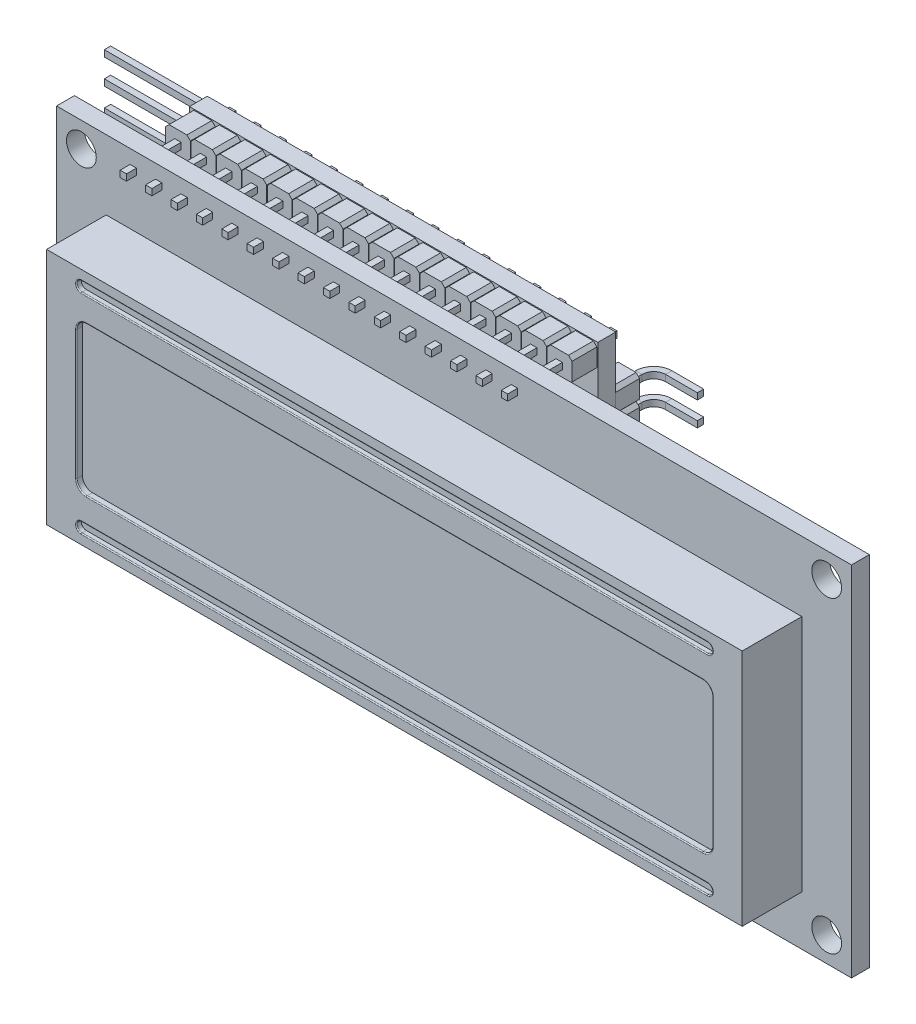
from build123d import *

# Parameters (mm, degrees)
SKETCH1_W                     = 80
SKETCH1_H                     = 36
SILICON_CHIP_DEPTH            = 1.8
SKETCH2_R                     = 1.5
SCREW_HOLES_DEPTH             = 1.8
PINS_DEPTH                    = 1
PINS_DEPTH_BACK               = 10
SKETCH3_W                     = 0.639344262
SKETCH3_H                     = 0.639344262
SKETCH3_W_2                   = 0.639344263
PIN_HOLDERS_START             = -4.5
PIN_HOLDERS_DEPTH             = 2.5
SKETCH5_W                     = 41.1
SKETCH5_H                     = 18
SILICON_CHIP_2_DEPTH          = 1.8
SKETCH6_W                     = 7
SKETCH6_H                     = 7
VARIABLE_RESISTOR_DEPTH       = 5
SCREWDRIVER_HOLE_LVL_2_DEPTH  = 1
SKETCH8_R                     = 1.3
SCREW_DRIVER_HOLE_LVL_1_DEPTH = 0.1
PINHOLDERS_2_DEPTH            = 2.5
SKETCH11_W                    = 0.64
SKETCH11_H                    = 0.64
BENT_PINS_COUNT               = 4
BENT_PINS_PITCH               = 2.54
SKETCH12_W                    = 7
SKETCH12_H                    = 10
IC_DEPTH                      = 2
SKETCH14_W                    = 0.5
SKETCH14_H                    = 0.5
IC_PINS_1_COUNT               = 8
IC_PINS_1_PITCH               = 1.1
IC_PINS_2_COPY_1_SKETCH_W     = 0.5
IC_PINS_2_COPY_1_SKETCH_H     = 0.5
IC_PINS_2_COPY_2_SKETCH_W     = 0.5
IC_PINS_2_COPY_2_SKETCH_H     = 0.5
IC_PINS_2_COPY_3_SKETCH_W     = 0.5
IC_PINS_2_COPY_3_SKETCH_H     = 0.5
IC_PINS_2_COPY_4_SKETCH_W     = 0.5
IC_PINS_2_COPY_4_SKETCH_H     = 0.5
IC_PINS_2_COPY_5_SKETCH_W     = 0.5
IC_PINS_2_COPY_5_SKETCH_H     = 0.5
IC_PINS_2_COPY_6_SKETCH_W     = 0.5
IC_PINS_2_COPY_6_SKETCH_H     = 0.5
IC_PINS_2_COPY_7_SKETCH_W     = 0.5
IC_PINS_2_COPY_7_SKETCH_H     = 0.5
PINHOLDERS_3_DEPTH            = 2.5
SKETCH20_W                    = 0.64
SKETCH20_H                    = 0.64
SKETCH21_W                    = 70
SKETCH21_H                    = 24
DISPLAY_BODY_DEPTH            = 6
DISPLAY_CUTS_DEPTH            = 0.5
FILLET1_R                     = 0.1
DISPLAY_SCREEN_DEPTH          = 0.1


with BuildPart() as part:
    # Sketch1 → silicon_chip (new body)
    with BuildSketch(Plane.XY):
        Rectangle(SKETCH1_W, SKETCH1_H)
    extrude(amount=SILICON_CHIP_DEPTH)

    # Sketch2 → screw_holes (cut)
    with BuildSketch(Plane.XY.offset(1.8)):
        with Locations((37.5, 15.5)):
            Circle(SKETCH2_R)
        with Locations((37.5, -15.5)):
            Circle(SKETCH2_R)
        with Locations((-37.5, -15.5)):
            Circle(SKETCH2_R)
        with Locations((-37.5, 15.5)):
            Circle(SKETCH2_R)
    extrude(amount=-SCREW_HOLES_DEPTH, mode=Mode.SUBTRACT)

    # Sketch3 → pins (add, two sides: drawn at the far end of the back side and taken through both)
    with BuildSketch(Plane.XY.offset(1.8).offset(-PINS_DEPTH_BACK)):
        with Locations((-32.280327869, 16.280327869)):
            Rectangle(SKETCH3_W, SKETCH3_H)
        with Locations((-29.72295082, 16.280327869)):
            Rectangle(SKETCH3_W, SKETCH3_H)
        with Locations((-27.165573771, 16.280327869)):
            Rectangle(SKETCH3_W_2, SKETCH3_H)
        with Locations((-24.608196721, 16.280327869)):
            Rectangle(SKETCH3_W, SKETCH3_H)
        with Locations((-22.050819672, 16.280327869)):
            Rectangle(SKETCH3_W, SKETCH3_H)
        with Locations((-19.493442623, 16.280327869)):
            Rectangle(SKETCH3_W, SKETCH3_H)
        with Locations((-16.936065574, 16.280327869)):
            Rectangle(SKETCH3_W, SKETCH3_H)
        with Locations((-14.378688524, 16.280327869)):
            Rectangle(SKETCH3_W_2, SKETCH3_H)
        with Locations((-11.821311475, 16.280327869)):
            Rectangle(SKETCH3_W_2, SKETCH3_H)
        with Locations((-9.263934426, 16.280327869)):
            Rectangle(SKETCH3_W, SKETCH3_H)
        with Locations((-6.706557377, 16.280327869)):
            Rectangle(SKETCH3_W, SKETCH3_H)
        with Locations((-4.149180328, 16.280327869)):
            Rectangle(SKETCH3_W, SKETCH3_H)
        with Locations((-1.591803279, 16.280327869)):
            Rectangle(SKETCH3_W, SKETCH3_H)
        with Locations((0.965573771, 16.280327869)):
            Rectangle(SKETCH3_W_2, SKETCH3_H)
        with Locations((3.52295082, 16.280327869)):
            Rectangle(SKETCH3_W, SKETCH3_H)
        with Locations((6.080327869, 16.280327869)):
            Rectangle(SKETCH3_W, SKETCH3_H)
    extrude(amount=PINS_DEPTH + PINS_DEPTH_BACK)

    # Sketch4 → pin_holders (add)
    with BuildSketch(Plane.XY.offset(1.8).offset(PIN_HOLDERS_START)):
        Polygon((-33.180327869, 17.533881259), (-31.380327869, 17.533881259), (-31.026774478, 17.180327869), (-31.026774478, 15.380327869), (-31.380327869, 15.026774478), (-33.180327869, 15.026774478), (-33.533881259, 15.380327869), (-33.533881259, 17.180327869), align=None)
        Polygon((-30.620327869, 17.533881259), (-28.820327869, 17.533881259), (-28.466774478, 17.180327869), (-28.466774478, 15.380327869), (-28.820327869, 15.026774478), (-30.620327869, 15.026774478), (-30.973881259, 15.380327869), (-30.973881259, 17.180327869), align=None)
        Polygon((-28.060327869, 17.533881259), (-26.260327869, 17.533881259), (-25.906774478, 17.180327869), (-25.906774478, 15.380327869), (-26.260327869, 15.026774478), (-28.060327869, 15.026774478), (-28.413881259, 15.380327869), (-28.413881259, 17.180327869), align=None)
        Polygon((-25.500327869, 17.533881259), (-23.700327869, 17.533881259), (-23.346774478, 17.180327869), (-23.346774478, 15.380327869), (-23.700327869, 15.026774478), (-25.500327869, 15.026774478), (-25.853881259, 15.380327869), (-25.853881259, 17.180327869), align=None)
        Polygon((-22.940327869, 17.533881259), (-21.140327869, 17.533881259), (-20.786774478, 17.180327869), (-20.786774478, 15.380327869), (-21.140327869, 15.026774478), (-22.940327869, 15.026774478), (-23.293881259, 15.380327869), (-23.293881259, 17.180327869), align=None)
        Polygon((-20.380327869, 17.533881259), (-18.580327869, 17.533881259), (-18.226774478, 17.180327869), (-18.226774478, 15.380327869), (-18.580327869, 15.026774478), (-20.380327869, 15.026774478), (-20.733881259, 15.380327869), (-20.733881259, 17.180327869), align=None)
        Polygon((-17.820327869, 17.533881259), (-16.020327869, 17.533881259), (-15.666774478, 17.180327869), (-15.666774478, 15.380327869), (-16.020327869, 15.026774478), (-17.820327869, 15.026774478), (-18.173881259, 15.380327869), (-18.173881259, 17.180327869), align=None)
        Polygon((-15.260327869, 17.533881259), (-13.460327869, 17.533881259), (-13.106774478, 17.180327869), (-13.106774478, 15.380327869), (-13.460327869, 15.026774478), (-15.260327869, 15.026774478), (-15.613881259, 15.380327869), (-15.613881259, 17.180327869), align=None)
        Polygon((-12.700327869, 17.533881259), (-10.900327869, 17.533881259), (-10.546774478, 17.180327869), (-10.546774478, 15.380327869), (-10.900327869, 15.026774478), (-12.700327869, 15.026774478), (-13.053881259, 15.380327869), (-13.053881259, 17.180327869), align=None)
        Polygon((-10.140327869, 17.533881259), (-8.340327869, 17.533881259), (-7.986774478, 17.180327869), (-7.986774478, 15.380327869), (-8.340327869, 15.026774478), (-10.140327869, 15.026774478), (-10.493881259, 15.380327869), (-10.493881259, 17.180327869), align=None)
        Polygon((-7.580327869, 17.533881259), (-5.780327869, 17.533881259), (-5.426774478, 17.180327869), (-5.426774478, 15.380327869), (-5.780327869, 15.026774478), (-7.580327869, 15.026774478), (-7.933881259, 15.380327869), (-7.933881259, 17.180327869), align=None)
        Polygon((-5.020327869, 17.533881259), (-3.220327869, 17.533881259), (-2.866774478, 17.180327869), (-2.866774478, 15.380327869), (-3.220327869, 15.026774478), (-5.020327869, 15.026774478), (-5.373881259, 15.380327869), (-5.373881259, 17.180327869), align=None)
        Polygon((-2.460327869, 17.533881259), (-0.660327869, 17.533881259), (-0.306774478, 17.180327869), (-0.306774478, 15.380327869), (-0.660327869, 15.026774478), (-2.460327869, 15.026774478), (-2.813881259, 15.380327869), (-2.813881259, 17.180327869), align=None)
        Polygon((0.099672131, 17.533881259), (1.899672131, 17.533881259), (2.253225522, 17.180327869), (2.253225522, 15.380327869), (1.899672131, 15.026774478), (0.099672131, 15.026774478), (-0.253881259, 15.380327869), (-0.253881259, 17.180327869), align=None)
        Polygon((2.659672131, 17.533881259), (4.459672131, 17.533881259), (4.813225522, 17.180327869), (4.813225522, 15.380327869), (4.459672131, 15.026774478), (2.659672131, 15.026774478), (2.306118741, 15.380327869), (2.306118741, 17.180327869), align=None)
        Polygon((5.219672131, 17.533881259), (7.019672131, 17.533881259), (7.373225522, 17.180327869), (7.373225522, 15.380327869), (7.019672131, 15.026774478), (5.219672131, 15.026774478), (4.866118741, 15.380327869), (4.866118741, 17.180327869), align=None)
    extrude(amount=-PIN_HOLDERS_DEPTH)

    # Sketch5 → silicon_chip_2 (add)
    with BuildSketch(Plane(origin=(0, 0, -5.2), x_dir=(-1, 0, 0), z_dir=(0, 0, -1))):
        with Locations((13.076774478, 8.633881259)):
            Rectangle(SKETCH5_W, SKETCH5_H)
    extrude(amount=SILICON_CHIP_2_DEPTH)

    # Sketch6 → variable_resistor (add)
    with BuildSketch(Plane(origin=(0, 0, -7), x_dir=(-1, 0, 0), z_dir=(0, 0, -1))):
        with Locations((25.126774478, 9.133881259)):
            Rectangle(SKETCH6_W, SKETCH6_H)
    extrude(amount=VARIABLE_RESISTOR_DEPTH)

    # Sketch7 → screwdriver_hole_lvl_2 (cut)
    with BuildSketch(Plane(origin=(0, 0, -12), x_dir=(-1, 0, 0), z_dir=(0, 0, -1))):
        Polygon((25.376774478, 9.383881259), (26.376774478, 9.383881259), (26.376774478, 8.883881259), (25.376774478, 8.883881259), (25.376774478, 7.883881259), (24.876774478, 7.883881259), (24.876774478, 8.883881259), (23.876774478, 8.883881259), (23.876774478, 9.383881259), (24.876774478, 9.383881259), (24.876774478, 10.383881259), (25.376774478, 10.383881259), align=None)
    extrude(amount=-SCREWDRIVER_HOLE_LVL_2_DEPTH, mode=Mode.SUBTRACT)

    # Sketch8 → screw_driver_hole_lvl_1 (cut)
    with BuildSketch(Plane(origin=(0, 0, -12), x_dir=(-1, 0, 0), z_dir=(0, 0, -1))):
        with Locations((25.126774478, 9.133881259)):
            Circle(SKETCH8_R)
    extrude(amount=-SCREW_DRIVER_HOLE_LVL_1_DEPTH, mode=Mode.SUBTRACT)

    # Sketch9 → pinholders_2 (add)
    with BuildSketch(Plane(origin=(0, 0, -7), x_dir=(-1, 0, 0), z_dir=(0, 0, -1))):
        Polygon((31.373221088, 12.633881259), (33.173221088, 12.633881259), (33.526774478, 12.280327869), (33.526774478, 10.480327869), (33.173221088, 10.126774478), (31.373221088, 10.126774478), (31.019667697, 10.480327869), (31.019667697, 12.280327869), align=None)
        Polygon((33.526774478, 7.963221088), (33.173221088, 7.609667697), (31.373221088, 7.609667697), (31.019667697, 7.963221088), (31.019667697, 9.763221088), (31.373221088, 10.116774478), (33.173221088, 10.116774478), (33.526774478, 9.763221088), align=None)
        Polygon((33.526774478, 5.446114306), (33.173221088, 5.092560916), (31.373221088, 5.092560916), (31.019667697, 5.446114306), (31.019667697, 7.246114306), (31.373221088, 7.599667697), (33.173221088, 7.599667697), (33.526774478, 7.246114306), align=None)
        Polygon((33.526774478, 2.929007525), (33.173221088, 2.575454135), (31.373221088, 2.575454135), (31.019667697, 2.929007525), (31.019667697, 4.729007525), (31.373221088, 5.082560916), (33.173221088, 5.082560916), (33.526774478, 4.729007525), align=None)
    extrude(amount=PINHOLDERS_2_DEPTH)

    # bent_pin: sweep along a path in Sketch10
    with BuildLine(Plane(origin=(0, 11.375454135, 0), x_dir=(-1, 0, 0), z_dir=(0, -1, 0))) as bent_pin_path:
        Line((32.3, 9.5), (32.3, 10.6))
        ThreePointArc((32.3, 10.6), (32.739339828, 11.660660172), (33.8, 12.1))
        Line((33.8, 12.1), (48.8, 12.1))
    # Sketch11 → bent_pin (sweep)
    with BuildSketch(Plane(origin=(0, 0, -9.5), x_dir=(-1, 0, 0), z_dir=(0, 0, -1))):
        with Locations((32.273221088, 11.380327869)):
            Rectangle(SKETCH11_W, SKETCH11_H)
    bent_pin = sweep(path=bent_pin_path.line)

    # bent_pins: bent_pin ×4
    with Locations(*[(0, -i * BENT_PINS_PITCH, 0) for i in range(1, BENT_PINS_COUNT)]):
        add(bent_pin)

    # Sketch12 → ic (add)
    with BuildSketch(Plane(origin=(0, 0, -7), x_dir=(-1, 0, 0), z_dir=(0, 0, -1))):
        with Locations((14.126774478, 7.633881259)):
            Rectangle(SKETCH12_W, SKETCH12_H)
    extrude(amount=IC_DEPTH)

    # IC_pin: sweep along a path in Sketch13
    with BuildLine(Plane(origin=(0, 3.633881259, 0), x_dir=(-1, 0, 0), z_dir=(0, -1, 0))) as ic_pin_path:
        Line((17.626774478, 8.4), (17.8, 8.4))
        ThreePointArc((17.8, 8.4), (18.082842712, 8.282842712), (18.2, 8))
        Line((18.2, 8), (18.2, 7.4))
        ThreePointArc((18.2, 7.4), (18.317157288, 7.117157288), (18.6, 7))
        Line((18.6, 7), (18.8, 7))
    # Sketch14 → IC_pin (sweep)
    with BuildSketch(Plane.ZY.offset(17.626774478)):
        with Locations((-8.4, 3.633881259)):
            Rectangle(SKETCH14_W, SKETCH14_H)
    ic_pin = sweep(path=ic_pin_path.line)

    # IC_pins_1: IC_pin ×8
    with Locations(*[(0, i * IC_PINS_1_PITCH, 0) for i in range(1, IC_PINS_1_COUNT)]):
        add(ic_pin)

    # IC_pins_2: IC_pin across plane
    add(ic_pin.mirror(Plane(origin=(-14.126774478, 0, 0), x_dir=(0, 0, 1), z_dir=(1, 0, 0))))

    # IC_pins_2 copy 1: sweep along a path in IC_pins_2 copy 1 path
    with BuildLine(Plane(origin=(-28.253548957, 4.733881259, 0), x_dir=(1, 0, 0), z_dir=(0, -1, 0))) as ic_pins_2_copy_1_path:
        Line((17.626774478, -8.4), (17.8, -8.4))
        ThreePointArc((17.8, -8.4), (18.082842712, -8.282842712), (18.2, -8))
        Line((18.2, -8), (18.2, -7.4))
        ThreePointArc((18.2, -7.4), (18.317157288, -7.117157288), (18.6, -7))
        Line((18.6, -7), (18.8, -7))
    # IC_pins_2 copy 1 sketch → IC_pins_2 copy 1 (sweep)
    with BuildSketch(Plane(origin=(-10.626774478, 1.1, 0), x_dir=(0, 0, 1), z_dir=(1, 0, 0))):
        with Locations((-8.4, -3.633881259)):
            Rectangle(IC_PINS_2_COPY_1_SKETCH_W, IC_PINS_2_COPY_1_SKETCH_H)
    sweep(path=ic_pins_2_copy_1_path.line)

    # IC_pins_2 copy 2: sweep along a path in IC_pins_2 copy 2 path
    with BuildLine(Plane(origin=(-28.253548957, 5.833881259, 0), x_dir=(1, 0, 0), z_dir=(0, -1, 0))) as ic_pins_2_copy_2_path:
        Line((17.626774478, -8.4), (17.8, -8.4))
        ThreePointArc((17.8, -8.4), (18.082842712, -8.282842712), (18.2, -8))
        Line((18.2, -8), (18.2, -7.4))
        ThreePointArc((18.2, -7.4), (18.317157288, -7.117157288), (18.6, -7))
        Line((18.6, -7), (18.8, -7))
    # IC_pins_2 copy 2 sketch → IC_pins_2 copy 2 (sweep)
    with BuildSketch(Plane(origin=(-10.626774478, 2.2, 0), x_dir=(0, 0, 1), z_dir=(1, 0, 0))):
        with Locations((-8.4, -3.633881259)):
            Rectangle(IC_PINS_2_COPY_2_SKETCH_W, IC_PINS_2_COPY_2_SKETCH_H)
    sweep(path=ic_pins_2_copy_2_path.line)

    # IC_pins_2 copy 3: sweep along a path in IC_pins_2 copy 3 path
    with BuildLine(Plane(origin=(-28.253548957, 6.933881259, 0), x_dir=(1, 0, 0), z_dir=(0, -1, 0))) as ic_pins_2_copy_3_path:
        Line((17.626774478, -8.4), (17.8, -8.4))
        ThreePointArc((17.8, -8.4), (18.082842712, -8.282842712), (18.2, -8))
        Line((18.2, -8), (18.2, -7.4))
        ThreePointArc((18.2, -7.4), (18.317157288, -7.117157288), (18.6, -7))
        Line((18.6, -7), (18.8, -7))
    # IC_pins_2 copy 3 sketch → IC_pins_2 copy 3 (sweep)
    with BuildSketch(Plane(origin=(-10.626774478, 3.3, 0), x_dir=(0, 0, 1), z_dir=(1, 0, 0))):
        with Locations((-8.4, -3.633881259)):
            Rectangle(IC_PINS_2_COPY_3_SKETCH_W, IC_PINS_2_COPY_3_SKETCH_H)
    sweep(path=ic_pins_2_copy_3_path.line)

    # IC_pins_2 copy 4: sweep along a path in IC_pins_2 copy 4 path
    with BuildLine(Plane(origin=(-28.253548957, 8.033881259, 0), x_dir=(1, 0, 0), z_dir=(0, -1, 0))) as ic_pins_2_copy_4_path:
        Line((17.626774478, -8.4), (17.8, -8.4))
        ThreePointArc((17.8, -8.4), (18.082842712, -8.282842712), (18.2, -8))
        Line((18.2, -8), (18.2, -7.4))
        ThreePointArc((18.2, -7.4), (18.317157288, -7.117157288), (18.6, -7))
        Line((18.6, -7), (18.8, -7))
    # IC_pins_2 copy 4 sketch → IC_pins_2 copy 4 (sweep)
    with BuildSketch(Plane(origin=(-10.626774478, 4.4, 0), x_dir=(0, 0, 1), z_dir=(1, 0, 0))):
        with Locations((-8.4, -3.633881259)):
            Rectangle(IC_PINS_2_COPY_4_SKETCH_W, IC_PINS_2_COPY_4_SKETCH_H)
    sweep(path=ic_pins_2_copy_4_path.line)

    # IC_pins_2 copy 5: sweep along a path in IC_pins_2 copy 5 path
    with BuildLine(Plane(origin=(-28.253548957, 9.133881259, 0), x_dir=(1, 0, 0), z_dir=(0, -1, 0))) as ic_pins_2_copy_5_path:
        Line((17.626774478, -8.4), (17.8, -8.4))
        ThreePointArc((17.8, -8.4), (18.082842712, -8.282842712), (18.2, -8))
        Line((18.2, -8), (18.2, -7.4))
        ThreePointArc((18.2, -7.4), (18.317157288, -7.117157288), (18.6, -7))
        Line((18.6, -7), (18.8, -7))
    # IC_pins_2 copy 5 sketch → IC_pins_2 copy 5 (sweep)
    with BuildSketch(Plane(origin=(-10.626774478, 5.5, 0), x_dir=(0, 0, 1), z_dir=(1, 0, 0))):
        with Locations((-8.4, -3.633881259)):
            Rectangle(IC_PINS_2_COPY_5_SKETCH_W, IC_PINS_2_COPY_5_SKETCH_H)
    sweep(path=ic_pins_2_copy_5_path.line)

    # IC_pins_2 copy 6: sweep along a path in IC_pins_2 copy 6 path
    with BuildLine(Plane(origin=(-28.253548957, 10.233881259, 0), x_dir=(1, 0, 0), z_dir=(0, -1, 0))) as ic_pins_2_copy_6_path:
        Line((17.626774478, -8.4), (17.8, -8.4))
        ThreePointArc((17.8, -8.4), (18.082842712, -8.282842712), (18.2, -8))
        Line((18.2, -8), (18.2, -7.4))
        ThreePointArc((18.2, -7.4), (18.317157288, -7.117157288), (18.6, -7))
        Line((18.6, -7), (18.8, -7))
    # IC_pins_2 copy 6 sketch → IC_pins_2 copy 6 (sweep)
    with BuildSketch(Plane(origin=(-10.626774478, 6.6, 0), x_dir=(0, 0, 1), z_dir=(1, 0, 0))):
        with Locations((-8.4, -3.633881259)):
            Rectangle(IC_PINS_2_COPY_6_SKETCH_W, IC_PINS_2_COPY_6_SKETCH_H)
    sweep(path=ic_pins_2_copy_6_path.line)

    # IC_pins_2 copy 7: sweep along a path in IC_pins_2 copy 7 path
    with BuildLine(Plane(origin=(-28.253548957, 11.333881259, 0), x_dir=(1, 0, 0), z_dir=(0, -1, 0))) as ic_pins_2_copy_7_path:
        Line((17.626774478, -8.4), (17.8, -8.4))
        ThreePointArc((17.8, -8.4), (18.082842712, -8.282842712), (18.2, -8))
        Line((18.2, -8), (18.2, -7.4))
        ThreePointArc((18.2, -7.4), (18.317157288, -7.117157288), (18.6, -7))
        Line((18.6, -7), (18.8, -7))
    # IC_pins_2 copy 7 sketch → IC_pins_2 copy 7 (sweep)
    with BuildSketch(Plane(origin=(-10.626774478, 7.7, 0), x_dir=(0, 0, 1), z_dir=(1, 0, 0))):
        with Locations((-8.4, -3.633881259)):
            Rectangle(IC_PINS_2_COPY_7_SKETCH_W, IC_PINS_2_COPY_7_SKETCH_H)
    sweep(path=ic_pins_2_copy_7_path.line)

    # Sketch16 → pinholders_3 (add)
    with BuildSketch(Plane(origin=(0, 0, -7), x_dir=(-1, 0, 0), z_dir=(0, 0, -1))):
        Polygon((-7.019672131, 12.633881259), (-5.219672131, 12.633881259), (-4.866118741, 12.280327869), (-4.866118741, 10.480327869), (-5.219672131, 10.126774478), (-7.019672131, 10.126774478), (-7.373225522, 10.480327869), (-7.373225522, 12.280327869), align=None)
        Polygon((-4.866118741, 7.963221088), (-5.219672131, 7.609667697), (-7.019672131, 7.609667697), (-7.373225522, 7.963221088), (-7.373225522, 9.763221088), (-7.019672131, 10.116774478), (-5.219672131, 10.116774478), (-4.866118741, 9.763221088), align=None)
    extrude(amount=PINHOLDERS_3_DEPTH)

    # bent_pin_2: sweep along a path in Sketch19
    with BuildLine(Plane(origin=(0, 8.909667697, 0), x_dir=(-1, 0, 0), z_dir=(0, -1, 0))) as bent_pin_2_path:
        Line((-6.2, 9.5), (-6.2, 10.60422882))
        ThreePointArc((-6.2, 10.60422882), (-6.639339828, 11.664888992), (-7.7, 12.10422882))
        Line((-7.7, 12.10422882), (-10.9, 12.10422882))
    # Sketch20 → bent_pin_2 (sweep)
    with BuildSketch(Plane(origin=(0, 0, -9.5), x_dir=(-1, 0, 0), z_dir=(0, 0, -1))):
        with Locations((-6.2, 8.909667697)):
            Rectangle(SKETCH20_W, SKETCH20_H)
    bent_pin_2 = sweep(path=bent_pin_2_path.line)

    # bent_pins_2: bent_pin_2 across plane
    add(bent_pin_2.mirror(Plane(origin=(5.219672131, 10.126774478, -9.5), x_dir=(0, 0, 1), z_dir=(0, 1, 0))))

    # Sketch21 → display_body (add)
    with BuildSketch(Plane.XY.offset(1.8)):
        with Locations((0, -1)):
            Rectangle(SKETCH21_W, SKETCH21_H)
    extrude(amount=DISPLAY_BODY_DEPTH)

    # Sketch22 → display_cuts (cut)
    with BuildSketch(Plane.XY.offset(7.8)):
        with BuildLine():
            Line((-31.5, 10), (31.5, 10))
            ThreePointArc((31.5, 10), (32, 9.5), (31.5, 9))
            Line((31.5, 9), (-31.5, 9))
            ThreePointArc((-31.5, 9), (-32, 9.5), (-31.5, 10))
        make_face()
        with BuildLine():
            Line((31.5, -11), (-31.5, -11))
            ThreePointArc((-31.5, -11), (-32, -11.5), (-31.5, -12))
            Line((-31.5, -12), (31.5, -12))
            ThreePointArc((31.5, -12), (32, -11.5), (31.5, -11))
        make_face()
        with BuildLine():
            Line((-31, 6.5), (31, 6.5))
            ThreePointArc((31, 6.5), (31.707106781, 6.207106781), (32, 5.5))
            Line((32, 5.5), (32, -7.5))
            ThreePointArc((32, -7.5), (31.707106781, -8.207106781), (31, -8.5))
            Line((31, -8.5), (-31, -8.5))
            ThreePointArc((-31, -8.5), (-31.707106781, -8.207106781), (-32, -7.5))
            Line((-32, -7.5), (-32, 5.5))
            ThreePointArc((-32, 5.5), (-31.707106781, 6.207106781), (-31, 6.5))
        make_face()
    extrude(amount=-DISPLAY_CUTS_DEPTH, mode=Mode.SUBTRACT)

    # Fillet1
    fillet1_edges = [part.edges().sort_by_distance(p)[0] for p in [
        (-32, 9.5, 7.8),
        (0, 9, 7.8),
        (32, 9.5, 7.8),
        (0, 10, 7.8),
        (32, -11.5, 7.8),
        (0, -11, 7.8),
        (-32, -11.5, 7.8),
        (0, -12, 7.8),
        (31.707106781, 6.207106781, 7.8),
        (0, 6.5, 7.8),
        (-31.707106781, 6.207106781, 7.8),
        (-32, -1, 7.8),
        (-31.707106781, -8.207106781, 7.8),
        (0, -8.5, 7.8),
        (31.707106781, -8.207106781, 7.8),
        (32, -1, 7.8),
    ]]
    fillet(fillet1_edges, radius=FILLET1_R)

    # Sketch24 → display_screen (cut)
    with BuildSketch(Plane.XY.offset(7.3)):
        with BuildLine():
            Line((-31, 6.5), (31, 6.5))
            ThreePointArc((31, 6.5), (31.707106781, 6.207106781), (32, 5.5))
            Line((32, 5.5), (32, -7.5))
            ThreePointArc((32, -7.5), (31.707106781, -8.207106781), (31, -8.5))
            Line((31, -8.5), (-31, -8.5))
            ThreePointArc((-31, -8.5), (-31.707106781, -8.207106781), (-32, -7.5))
            Line((-32, -7.5), (-32, 5.5))
            ThreePointArc((-32, 5.5), (-31.707106781, 6.207106781), (-31, 6.5))
        make_face()
    extrude(amount=-DISPLAY_SCREEN_DEPTH, mode=Mode.SUBTRACT)


solid = part.part
